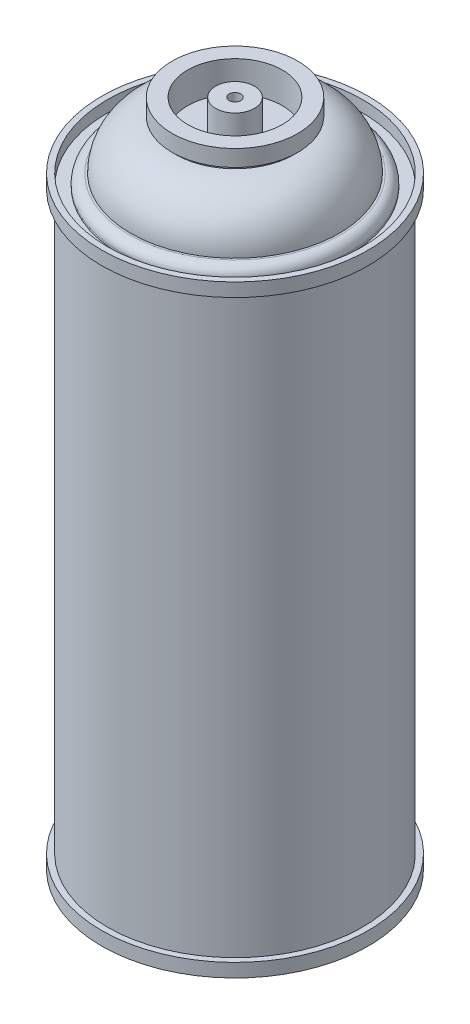
from build123d import *

# Parameters (mm, degrees)
SKETCH1_R           = 33
BOSS_EXTRUDE1_DEPTH = 156
SKETCH3_R           = 34.5
BOSS_EXTRUDE2_DEPTH = 3.5
LPATTERN1_COUNT     = 2
LPATTERN1_PITCH     = 152.5
SKETCH6_R           = 1.5
CUT_EXTRUDE1_DEPTH  = 3.5
CUT_EXTRUDE2_START  = -3
SKETCH7_R           = 33
SKETCH7_R_2         = 30
CUT_EXTRUDE2_DEPTH  = 3
FILLET1_R           = 2.5


with BuildPart() as part:
    # Sketch1 → Boss-Extrude1 (new body)
    with BuildSketch(Plane(origin=(0, 0, 0), x_dir=(1, 0, 0), z_dir=(0, 1, 0))):
        Circle(SKETCH1_R)
    extrude(amount=BOSS_EXTRUDE1_DEPTH)

    # Sketch2 → Revolve1 (revolve)
    with BuildSketch(Plane(origin=(0, 0, 0), x_dir=(0, 0, -1), z_dir=(1, 0, 0))):
        with BuildLine():
            Line((15.25, 167.75), (15.25, 168.75))
            Line((15.25, 168.75), (16.25, 168.75))
            Line((16.25, 168.75), (16.25, 173))
            Line((16.25, 173), (12.25, 173))
            Line((12.25, 173), (12.25, 165))
            Line((12.25, 165), (5, 165))
            Line((5, 165), (5, 173))
            Line((5, 173), (0, 173))
            Line((0, 173), (0, 156))
            Line((0, 156), (27, 156))
            ThreePointArc((27, 156), (23.558504679, 164.308504679), (15.25, 167.75))
        make_face()
    revolve(axis=Axis((0, 173, 0), (0, -1, 0)))

    # Sketch3 → Boss-Extrude2 (add)
    with BuildSketch(Plane(origin=(0, 156, 0), x_dir=(1, 0, 0), z_dir=(0, 1, 0))):
        Circle(SKETCH3_R)
    boss_extrude2 = extrude(amount=-BOSS_EXTRUDE2_DEPTH)

    # LPattern1: Boss-Extrude2 ×2
    with Locations(*[(0, -i * LPATTERN1_PITCH, 0) for i in range(1, LPATTERN1_COUNT)]):
        add(boss_extrude2)

    # Sketch5 → Cut-Revolve1 (revolve, cut)
    with BuildSketch(Plane.XY):
        with BuildLine():
            Line((0, 0), (-32.5, 0))
            ThreePointArc((-32.5, 0), (-17.322312201, 8.904178879), (0, 12))
            Line((0, 12), (0, 0))
        make_face()
    revolve(axis=Axis((0, 12, 0), (0, -1, 0)), mode=Mode.SUBTRACT)

    # Sketch6 → Cut-Extrude1 (cut)
    with BuildSketch(Plane(origin=(0, 173, 0), x_dir=(1, 0, 0), z_dir=(0, 1, 0))):
        Circle(SKETCH6_R)
    extrude(amount=-CUT_EXTRUDE1_DEPTH, mode=Mode.SUBTRACT)

    # Sketch7 → Cut-Extrude2 (cut)
    with BuildSketch(Plane(origin=(0, 156, 0), x_dir=(1, 0, 0), z_dir=(0, 1, 0)).offset(CUT_EXTRUDE2_START)):
        Circle(SKETCH7_R)
        Circle(SKETCH7_R_2, mode=Mode.SUBTRACT)
    extrude(amount=CUT_EXTRUDE2_DEPTH, mode=Mode.SUBTRACT)

    # Fillet1
    fillet1_edges = [part.edges().sort_by_distance(p)[0] for p in [
        (-30, 156, 0),
    ]]
    fillet(fillet1_edges, radius=FILLET1_R)


solid = part.part
